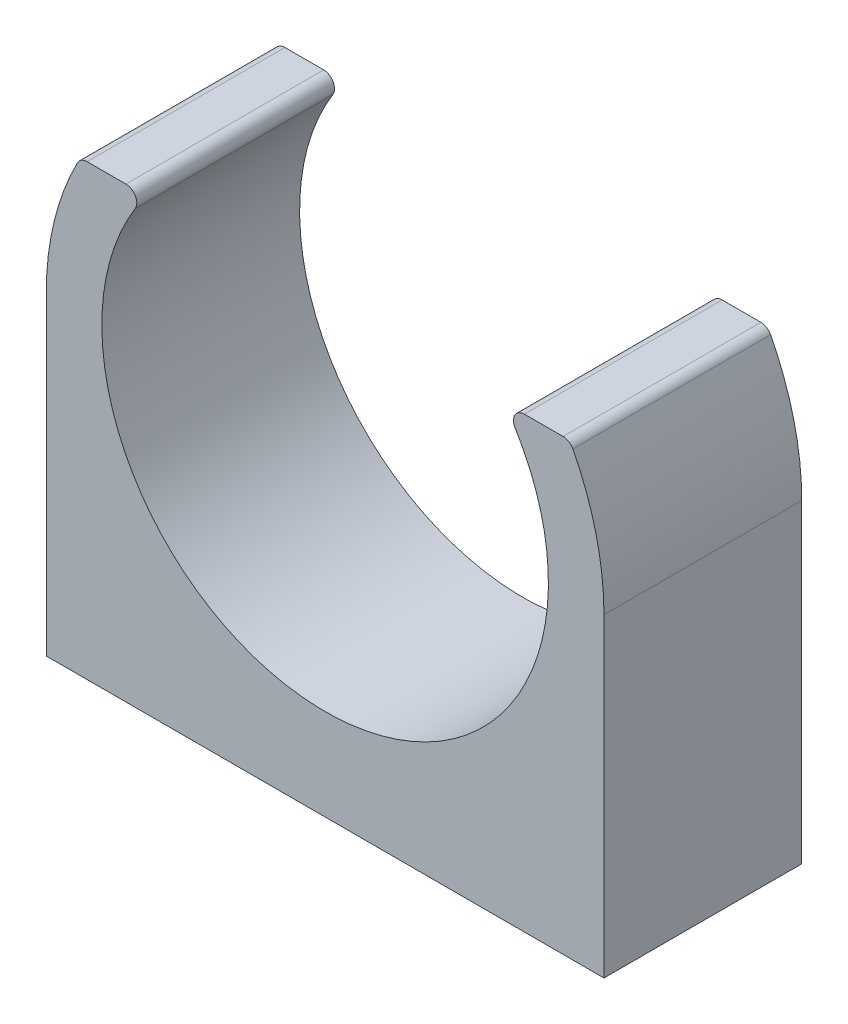
from build123d import *

# Parameters (mm, degrees)
BOSS_EXTRUDE1_DEPTH = 15
FILLET1_R           = 0.8255


with BuildPart() as part:
    # Sketch1 → Boss-Extrude1 (new body)
    with BuildSketch(Plane.XY):
        with BuildLine():
            Line((-21.15, 20.111200005), (-21.15, -3.75))
            Line((-21.15, -3.75), (21.15, -3.75))
            Line((21.15, -3.75), (21.15, 20.111200005))
            ThreePointArc((21.15, 20.111200005), (20.489653579, 25.354919699), (18.549849056, 30.271200005))
            Line((18.549849056, 30.271200005), (13.550249835, 30.271200005))
            ThreePointArc((13.550249835, 30.271200005), (0, 3.175), (-13.550249835, 30.271200005))
            Line((-13.550249835, 30.271200005), (-18.549849056, 30.271200005))
            ThreePointArc((-18.549849056, 30.271200005), (-20.489653579, 25.354919699), (-21.15, 20.111200005))
        make_face()
    extrude(amount=BOSS_EXTRUDE1_DEPTH)

    # Fillet1
    fillet1_edges = [part.edges().sort_by_distance(p)[0] for p in [
        (13.550249835, 30.271200005, 7.5),
        (-13.550249835, 30.271200005, 7.5),
        (18.549849056, 30.271200005, 7.5),
        (-18.549849056, 30.271200005, 7.5),
    ]]
    fillet(fillet1_edges, radius=FILLET1_R)


solid = part.part
